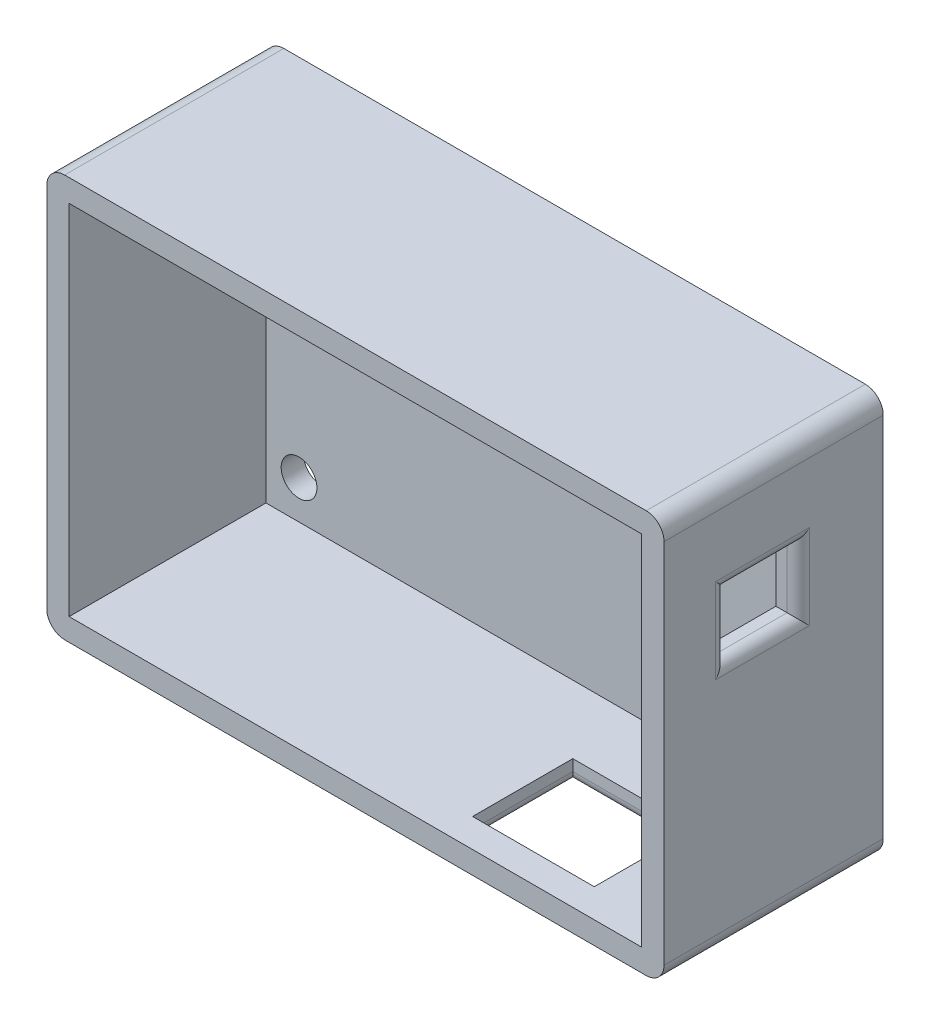
from build123d import *

# Parameters (mm, degrees)
SKETCH1_W           = 87.63
SKETCH1_H           = 57.15
BOSS_EXTRUDE1_DEPTH = 31.115
SKETCH2_W           = 81.28
SKETCH2_H           = 50.8
CUT_EXTRUDE1_DEPTH  = 27.94
SKETCH3_R           = 2.54
CUT_EXTRUDE2_DEPTH  = 60.303696765
FILLET2_R           = 2.54
CUT_EXTRUDE3_REACH  = 99.282
SKETCH4_W           = 10.16
SKETCH4_H           = 8.89
CUT_EXTRUDE4_REACH  = 80.448
SKETCH5_W           = 17.272
SKETCH5_H           = 14.224
FILLET4_R           = 1.5875
FILLET5_R           = 1.5875


with BuildPart() as part:
    # Sketch1 → Boss-Extrude1 (new body)
    with BuildSketch(Plane.XY):
        Rectangle(SKETCH1_W, SKETCH1_H)
    extrude(amount=BOSS_EXTRUDE1_DEPTH)

    # Sketch2 → Cut-Extrude1 (cut)
    with BuildSketch(Plane.XY.offset(31.115)):
        Rectangle(SKETCH2_W, SKETCH2_H)
    extrude(amount=-CUT_EXTRUDE1_DEPTH, mode=Mode.SUBTRACT)

    # Sketch3 → Cut-Extrude2 (cut, through all)
    with BuildSketch(Plane.XY.offset(3.175)):
        with Locations((-35.941, 19.939)):
            Circle(SKETCH3_R)
        with Locations((-35.941, -19.939)):
            Circle(SKETCH3_R)
        with Locations((35.941, -19.939)):
            Circle(SKETCH3_R)
        with Locations((35.941, 19.939)):
            Circle(SKETCH3_R)
    extrude(amount=-CUT_EXTRUDE2_DEPTH, mode=Mode.SUBTRACT)

    # Fillet2
    fillet2_edges = [part.edges().sort_by_distance(p)[0] for p in [
        (43.815, -28.575, 15.5575),
        (43.815, 28.575, 15.5575),
        (-43.815, -28.575, 15.5575),
        (-43.815, 28.575, 15.5575),
    ]]
    fillet(fillet2_edges, radius=FILLET2_R)

    # Sketch4 → Cut-Extrude3 (cut, up to next)
    with BuildSketch(Plane(origin=(43.815, 0, 0), x_dir=(0, 0, -1), z_dir=(1, 0, 0)), mode=Mode.PRIVATE) as cut_extrude3_sk1:
        with Locations((-17.145, 11.43)):
            Rectangle(SKETCH4_W, SKETCH4_H)
    cut_extrude3_tool1 = extrude(cut_extrude3_sk1.sketch, amount=-CUT_EXTRUDE3_REACH, mode=Mode.PRIVATE) & part.part
    add(cut_extrude3_tool1.solids().sort_by_distance((43.815, 11.43, 17.145))[0], mode=Mode.SUBTRACT)

    # Sketch5 → Cut-Extrude4 (cut, up to next)
    with BuildSketch(Plane.XZ.offset(28.575), mode=Mode.PRIVATE) as cut_extrude4_sk1:
        with Locations((21.209, 19.939)):
            Rectangle(SKETCH5_W, SKETCH5_H)
    cut_extrude4_tool1 = extrude(cut_extrude4_sk1.sketch, amount=-CUT_EXTRUDE4_REACH, mode=Mode.PRIVATE) & part.part
    add(cut_extrude4_tool1.solids().sort_by_distance((21.209, -28.575, 19.939))[0], mode=Mode.SUBTRACT)

    # Fillet4
    fillet4_edges = [part.edges().sort_by_distance(p)[0] for p in [
        (21.209, -28.575, 12.827),
        (29.845, -28.575, 19.939),
        (21.209, -28.575, 27.051),
        (12.573, -28.575, 19.939),
    ]]
    fillet(fillet4_edges, radius=FILLET4_R)

    # Fillet5
    fillet5_edges = [part.edges().sort_by_distance(p)[0] for p in [
        (43.815, 11.43, 12.065),
        (43.815, 15.875, 17.145),
        (43.815, 11.43, 22.225),
        (43.815, 6.985, 17.145),
    ]]
    fillet(fillet5_edges, radius=FILLET5_R)


solid = part.part
